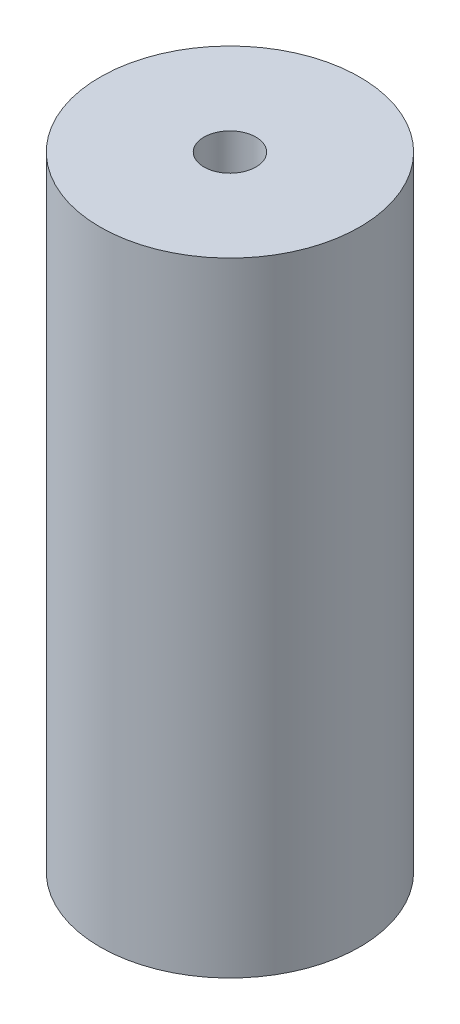
from build123d import *

# Parameters (mm, degrees)
ESQUISSE1_R             = 12.5
BOSS_EXTRU_1_DEPTH      = 60
ESQUISSE2_R             = 2.5
ENL_V_MAT_EXTRU_1_DEPTH = 60


with BuildPart() as part:
    # Esquisse1 → Boss.-Extru.1 (new body)
    with BuildSketch(Plane(origin=(0, 0, 0), x_dir=(1, 0, 0), z_dir=(0, 1, 0))):
        Circle(ESQUISSE1_R)
    extrude(amount=BOSS_EXTRU_1_DEPTH)

    # Esquisse2 → Enlèv. mat.-Extru.1 (cut)
    with BuildSketch(Plane.XZ):
        Circle(ESQUISSE2_R)
    extrude(amount=-ENL_V_MAT_EXTRU_1_DEPTH, mode=Mode.SUBTRACT)


solid = part.part
